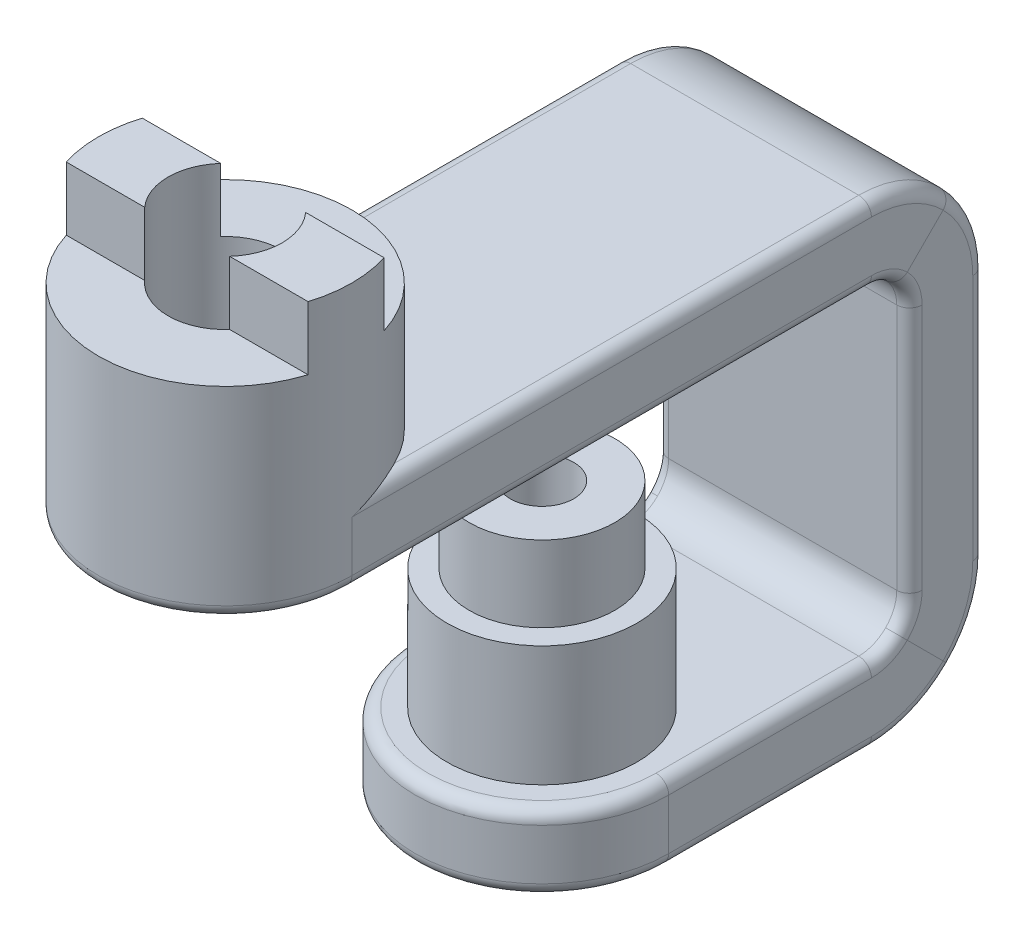
from build123d import *

# Parameters (mm, degrees)
SKETCH3_W                               = 40
SKETCH3_H                               = 12
BOSS_EXTRUDE1_DEPTH                     = 12
SKETCH5_R                               = 20
BOSS_EXTRUDE2_DEPTH                     = 20
BOSS_EXTRUDE2_DIRECTION_2_REACH         = 94.331
SKETCH7_R                               = 11.5
BOSS_EXTRUDE4_DEPTH                     = 31
SKETCH8_R                               = 15
BOSS_EXTRUDE5_DEPTH                     = 19
SKETCH9_R                               = 9
CUT_EXTRUDE1_DEPTH                      = 32
BOSS_EXTRUDE6_START                     = 10
BOSS_EXTRUDE6_DEPTH                     = 10
CBORE_FOR_M8_HEX_HEAD_BOLT1_D           = 10
CBORE_FOR_M8_HEX_HEAD_BOLT1_DEPTH       = 43
CBORE_FOR_M8_HEX_HEAD_BOLT1_CBORE_D     = 18.01
CBORE_FOR_M8_HEX_HEAD_BOLT1_CBORE_DEPTH = 5.68
CBORE_FOR_M8_HEX_HEAD_BOLT1_TIP         = 3.004303095
FILLET2_R                               = 18
FILLET3_R                               = 2
FILLET4_R                               = 6
FILLET5_R                               = 2


with BuildPart() as part:
    # Sweep1: sweep along a path in Sketch2
    with BuildLine(Plane(origin=(0, 0, 0), x_dir=(0, 0, -1), z_dir=(1, 0, 0))) as sweep1_path:
        Line((0, 0), (50, 0))
        Line((50, 0), (50, 75))
        Line((50, 75), (-50, 75))
    # Sketch3 → Sweep1 (sweep)
    with BuildSketch(Plane.XY):
        with Locations((0, 6)):
            Rectangle(SKETCH3_W, SKETCH3_H)
    sweep(path=sweep1_path.line, transition=Transition.RIGHT)

    # Sketch4 → Boss-Extrude1 (add)
    with BuildSketch(Plane(origin=(0, 12, 0), x_dir=(1, 0, 0), z_dir=(0, 1, 0))):
        with BuildLine():
            Line((-20, 0), (20, 0))
            ThreePointArc((20, 0), (0, -20), (-20, 0))
        make_face()
    extrude(amount=-BOSS_EXTRUDE1_DEPTH)

    # Sketch5 → Boss-Extrude2 (add)
    with BuildSketch(Plane(origin=(0, 75, 0), x_dir=(1, 0, 0), z_dir=(0, 1, 0))):
        with Locations(Location((0, -50, 0), (0, 0, 270))):
            Circle(SKETCH5_R)
    extrude(amount=BOSS_EXTRUDE2_DEPTH)

    # Boss-Extrude2 direction 2: up to this face of the body (flat: up to its plane)
    boss_extrude2_direction_2_end = Plane(part.part.faces().sort_by_distance((0, 63, 6))[0])
    # Sketch5 → Boss-Extrude2 direction 2 (add, up to the picked face)
    with BuildSketch(Plane(origin=(0, 75, 0), x_dir=(1, 0, 0), z_dir=(0, 1, 0)), mode=Mode.PRIVATE) as boss_extrude2_direction_2_sk1:
        with Locations(Location((0, -50, 0), (0, 0, 270))):
            Circle(SKETCH5_R)
    boss_extrude2_direction_2_tool1 = split(extrude(boss_extrude2_direction_2_sk1.sketch, amount=-BOSS_EXTRUDE2_DIRECTION_2_REACH, mode=Mode.PRIVATE), bisect_by=boss_extrude2_direction_2_end, keep=Keep.BOTH, mode=Mode.PRIVATE)
    add(boss_extrude2_direction_2_tool1.solids().sort_by(Axis((0, 75, 50), (0, -1, 0)))[0])

    # Sketch7 → Boss-Extrude4 (add)
    with BuildSketch(Plane(origin=(0, 12, 0), x_dir=(1, 0, 0), z_dir=(0, 1, 0))):
        with Locations(Location((0, 0, 0), (0, 0, 90))):
            Circle(SKETCH7_R)
    extrude(amount=BOSS_EXTRUDE4_DEPTH)

    # Sketch8 → Boss-Extrude5 (add)
    with BuildSketch(Plane(origin=(0, 12, 0), x_dir=(1, 0, 0), z_dir=(0, 1, 0))):
        with Locations(Location((0, 0, 0), (0, 0, 90))):
            Circle(SKETCH8_R)
    extrude(amount=BOSS_EXTRUDE5_DEPTH)

    # Sketch9 → Cut-Extrude1 (cut)
    with BuildSketch(Plane(origin=(0, 95, 0), x_dir=(1, 0, 0), z_dir=(0, 1, 0))):
        with Locations(Location((0, -50, 0), (0, 0, 270))):
            Circle(SKETCH9_R)
    extrude(amount=-CUT_EXTRUDE1_DEPTH, mode=Mode.SUBTRACT)

    # Sketch10 → Boss-Extrude6 (add)
    with BuildSketch(Plane(origin=(0, 95, 0), x_dir=(1, 0, 0), z_dir=(0, 1, 0)).offset(BOSS_EXTRUDE6_START)):
        with BuildLine():
            Line((-19.078784028, -44), (-6.708203932, -44))
            ThreePointArc((-6.708203932, -44), (-9, -50), (-6.708203932, -56))
            Line((-6.708203932, -56), (-19.078784028, -56))
            ThreePointArc((-19.078784028, -56), (-20, -50), (-19.078784028, -44))
        make_face()
        with BuildLine():
            Line((6.708203932, -44), (19.078784028, -44))
            ThreePointArc((19.078784028, -44), (20, -50), (19.078784028, -56))
            Line((19.078784028, -56), (6.708203932, -56))
            ThreePointArc((6.708203932, -56), (9, -50), (6.708203932, -44))
        make_face()
    extrude(amount=-BOSS_EXTRUDE6_DEPTH)

    # CBORE for M8 Hex Head Bolt1
    with Locations(Plane(origin=(0, 0, 0), x_dir=(-1, 0, 0), z_dir=(0, -1, 0))):
        with Locations((0, 0)):
            CounterBoreHole(CBORE_FOR_M8_HEX_HEAD_BOLT1_D / 2, CBORE_FOR_M8_HEX_HEAD_BOLT1_CBORE_D / 2, CBORE_FOR_M8_HEX_HEAD_BOLT1_CBORE_DEPTH, depth=CBORE_FOR_M8_HEX_HEAD_BOLT1_DEPTH)
            with Locations((0, 0, -(CBORE_FOR_M8_HEX_HEAD_BOLT1_DEPTH + CBORE_FOR_M8_HEX_HEAD_BOLT1_TIP / 2))):  # 118° drill point
                Cone(0, CBORE_FOR_M8_HEX_HEAD_BOLT1_D / 2, CBORE_FOR_M8_HEX_HEAD_BOLT1_TIP, mode=Mode.SUBTRACT)

    # Fillet2
    fillet2_edges = [part.edges().sort_by_distance(p)[0] for p in [
        (0, 75, -50),
        (0, 0, -50),
    ]]
    fillet(fillet2_edges, radius=FILLET2_R)

    # Fillet3
    # the kernel refuses this fillet: 2 mm, written as the material it takes off along each edge
    with BuildSketch(Plane(origin=(20, 18, -32), x_dir=(0, -1, 0), z_dir=(0, 0, 1))) as fillet3_piece_1:
        with BuildLine():
            CenterArc((18 - FILLET3_R, -FILLET3_R), FILLET3_R, 0, 90)
            Line((18 - FILLET3_R, 0), (18, 0))
            Line((18, 0), (18, -FILLET3_R))
        make_face()
    revolve(axis=Axis((20, 18, -32), (1, 0, 0)), revolution_arc=90, mode=Mode.SUBTRACT)
    with BuildSketch(Plane(origin=(20, 18, -50), x_dir=(0, 0, 1), z_dir=(0, 1, 0))) as fillet3_piece_2:
        with BuildLine():
            CenterArc((FILLET3_R, -FILLET3_R), FILLET3_R, 90, 90)
            Line((0, -FILLET3_R), (0, 0))
            Line((0, 0), (FILLET3_R, 0))
        make_face()
    extrude(amount=39, mode=Mode.SUBTRACT)
    with BuildSketch(Plane(origin=(20, 57, -32), x_dir=(0, 0, -1), z_dir=(0, -1, 0))) as fillet3_piece_3:
        with BuildLine():
            CenterArc((18 - FILLET3_R, -FILLET3_R), FILLET3_R, 360, 90)
            Line((18, -FILLET3_R), (18, 0))
            Line((18, 0), (18 - FILLET3_R, 0))
        make_face()
    revolve(axis=Axis((20, 57, -32), (1, 0, 0)), revolution_arc=90, mode=Mode.SUBTRACT)
    with BuildSketch(Plane(origin=(-20, 18, -50), x_dir=(0, 0, 1), z_dir=(0, 1, 0))) as fillet3_piece_4:
        with BuildLine():
            CenterArc((FILLET3_R, FILLET3_R), FILLET3_R, 180, 90)
            Line((0, FILLET3_R), (0, 0))
            Line((0, 0), (FILLET3_R, 0))
        make_face()
    extrude(amount=39, mode=Mode.SUBTRACT)
    with BuildSketch(Plane(origin=(-20, 57, -32), x_dir=(0, 0, -1), z_dir=(0, -1, 0))) as fillet3_piece_5:
        with BuildLine():
            CenterArc((18 - FILLET3_R, FILLET3_R), FILLET3_R, 270, 90)
            Line((18, FILLET3_R), (18, 0))
            Line((18, 0), (18 - FILLET3_R, 0))
        make_face()
    revolve(axis=Axis((-20, 57, -32), (1, 0, 0)), revolution_arc=90, mode=Mode.SUBTRACT)
    with BuildSketch(Plane(origin=(-20, 18, -32), x_dir=(0, -1, 0), z_dir=(0, 0, 1))) as fillet3_piece_6:
        with BuildLine():
            CenterArc((18 - FILLET3_R, FILLET3_R), FILLET3_R, 270, 90)
            Line((18, FILLET3_R), (18, 0))
            Line((18, 0), (18 - FILLET3_R, 0))
        make_face()
    revolve(axis=Axis((-20, 18, -32), (1, 0, 0)), revolution_arc=90, mode=Mode.SUBTRACT)
    with BuildSketch(Plane(origin=(20, 75, -32), x_dir=(0, -1, 0), z_dir=(0, 0, 1))) as fillet3_piece_7_section:
        with BuildLine():
            CenterArc((FILLET3_R, -FILLET3_R), FILLET3_R, 90, 90)
            Line((0, -FILLET3_R), (0, 0))
            Line((0, 0), (FILLET3_R, 0))
        make_face()
    fillet3_piece_7 = extrude(amount=87, mode=Mode.PRIVATE)
    fillet3_piece_7 = fillet3_piece_7 - Plane(origin=(0, 74.534164158, 50), x_dir=(0, 0, 1), z_dir=(0, -1, 0)) * Cylinder(20, 183, mode=Mode.PRIVATE)
    add(fillet3_piece_7, mode=Mode.SUBTRACT)
    with BuildSketch(Plane(origin=(-20, 75, -32), x_dir=(0, -1, 0), z_dir=(0, 0, 1))) as fillet3_piece_8_section:
        with BuildLine():
            CenterArc((FILLET3_R, FILLET3_R), FILLET3_R, 180, 90)
            Line((0, FILLET3_R), (0, 0))
            Line((0, 0), (FILLET3_R, 0))
        make_face()
    fillet3_piece_8 = extrude(amount=87, mode=Mode.PRIVATE)
    fillet3_piece_8 = fillet3_piece_8 - Plane(origin=(0, 74.534164167, 50), x_dir=(0, 0, 1), z_dir=(0, -1, 0)) * Cylinder(20, 183, mode=Mode.PRIVATE)
    add(fillet3_piece_8, mode=Mode.SUBTRACT)
    with BuildSketch(Plane(origin=(-20, 0, 0), x_dir=(1, 0, 0), z_dir=(0, 0, -1))) as fillet3_piece_9:
        with BuildLine():
            CenterArc((FILLET3_R, -FILLET3_R), FILLET3_R, 90, 90)
            Line((0, -FILLET3_R), (0, 0))
            Line((0, 0), (FILLET3_R, 0))
        make_face()
    extrude(amount=32, mode=Mode.SUBTRACT)
    with BuildSketch(Plane(origin=(0, 0, 0), x_dir=(1, 0, 0), z_dir=(0, 0, -1))) as fillet3_piece_10:
        with BuildLine():
            CenterArc((20 - FILLET3_R, -FILLET3_R), FILLET3_R, 0, 90)
            Line((20, -FILLET3_R), (20, 0))
            Line((20, 0), (20 - FILLET3_R, 0))
        make_face()
    revolve(axis=Axis((0, 0, 0), (0, -1, 0)), revolution_arc=180, mode=Mode.SUBTRACT)
    with BuildSketch(Plane(origin=(20, 0, 0), x_dir=(-1, 0, 0), z_dir=(0, 0, -1))) as fillet3_piece_11:
        with BuildLine():
            CenterArc((FILLET3_R, FILLET3_R), FILLET3_R, 180, 90)
            Line((0, FILLET3_R), (0, 0))
            Line((0, 0), (FILLET3_R, 0))
        make_face()
    extrude(amount=32, mode=Mode.SUBTRACT)

    # Fillet4
    fillet4_edges = [part.edges().sort_by_distance(p)[0] for p in [
        (0, 63, -38),
        (0, 12, -38),
    ]]
    fillet(fillet4_edges, radius=FILLET4_R)

    # Fillet5
    fillet5_edges = [part.edges().sort_by_distance(p)[0] for p in [
        (20, 63, 9),
        (-20, 63, 9),
        (-20, 37.5, -38),
        (20, 37.5, -38),
        (20, 61.242640687, -36.242640687),
        (20, 61.242640687, -36.242640687),
        (-20, 61.242640687, -36.242640687),
        (-20, 61.242640687, -36.242640687),
        (20, 13.757359313, -36.242640687),
        (20, 13.757359313, -36.242640687),
        (-20, 13.757359313, -36.242640687),
        (-20, 13.757359313, -36.242640687),
        (-20, 12, -16),
        (0, 12, 20),
        (20, 12, -16),
        (-14.142135624, 63, 64.142135624),
    ]]
    fillet(fillet5_edges, radius=FILLET5_R)


solid = part.part
